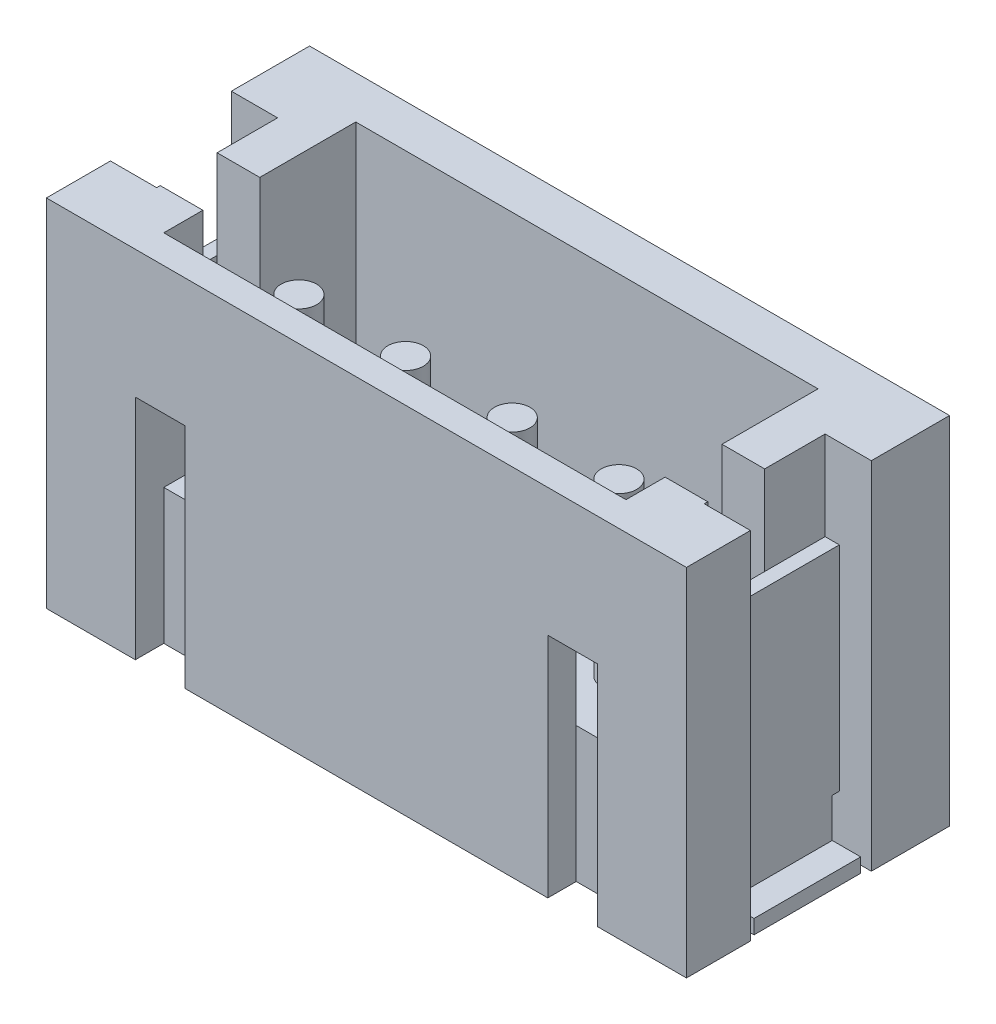
from build123d import *
from build123d.topology import SkipClean

# Parameters (mm, degrees)
BOSS_EXTRUDE1_START  = -2.55
BOSS_EXTRUDE1_DEPTH  = 5.1
SKETCH2_W            = 5.1
SKETCH2_H            = 1.9
BOSS_EXTRUDE2_DEPTH  = 1.75
SKETCH3_W            = 5.100000167
SKETCH3_H            = 0.4
BOSS_EXTRUDE3_DEPTH  = 3.1
SKETCH4_W            = 5.1
SKETCH4_H            = 1.6
BOSS_EXTRUDE4_DEPTH  = 1.05
BOSS_EXTRUDE5_DEPTH  = 0.700000167
SKETCH6_W            = 0.4
SKETCH6_H            = 1.8
BOSS_EXTRUDE6_DEPTH  = 0.7
SKETCH7_W            = 0.4
SKETCH7_H            = 1.8
BOSS_EXTRUDE7_DEPTH  = 0.7
BOSS_EXTRUDE8_DEPTH  = 0.7
SKETCH9_W            = 3.1
SKETCH9_H            = 5
BOSS_EXTRUDE9_DEPTH  = 1.25
SKETCH10_W           = 3.1
SKETCH10_H           = 5
BOSS_EXTRUDE10_DEPTH = 1.25
SKETCH11_W           = 9
SKETCH11_H           = 5
BOSS_EXTRUDE11_DEPTH = 0.6
CUT_EXTRUDE1_DEPTH   = 0.5
SKETCH13_W           = 0.45
SKETCH13_H           = 1.7
CUT_EXTRUDE2_DEPTH   = 8.677239185
CUT_EXTRUDE3_REACH   = 12.573
SKETCH14_W           = 0.8
SKETCH14_H           = 1.25
SKETCH15_W           = 0.85
SKETCH15_H           = 1.25
CUT_EXTRUDE4_DEPTH   = 0.2
SKETCH16_W           = 0.05
SKETCH16_H           = 1.25
CUT_EXTRUDE5_DEPTH   = 0.2
CUT_EXTRUDE6_REACH   = 8.647
SKETCH18_W           = 0.6
SKETCH18_H           = 0.8
SKETCH19_W           = 0.45
SKETCH19_H           = 1.7
CUT_EXTRUDE7_DEPTH   = 8.677239185
SKETCH20_W           = 0.8
SKETCH20_H           = 1.25
CUT_EXTRUDE8_DEPTH   = 11.573197246
SKETCH21_W           = 0.85
SKETCH21_H           = 1.25
CUT_EXTRUDE9_DEPTH   = 0.2
CUT_EXTRUDE10_REACH  = 12.412
SKETCH23_W           = 0.1
SKETCH23_H           = 0.75
SKETCH24_W           = 1.5
SKETCH24_H           = 0.2
BOSS_EXTRUDE12_DEPTH = 0.4
CUT_EXTRUDE11_REACH  = 12.412
SKETCH26_W           = 0.1
SKETCH26_H           = 0.75
CUT_EXTRUDE12_REACH  = 12.412
SKETCH28_W           = 0.75
SKETCH28_H           = 0.1
SKETCH29_W           = 1.5
SKETCH29_H           = 0.2
BOSS_EXTRUDE13_DEPTH = 0.4
CUT_EXTRUDE13_REACH  = 12.412
SKETCH31_W           = 0.75
SKETCH31_H           = 0.1
SKETCH32_W           = 0.05
SKETCH32_H           = 1.25
CUT_EXTRUDE14_DEPTH  = 0.2
CUT_EXTRUDE15_REACH  = 8.647
SKETCH34_W           = 0.6
SKETCH34_H           = 0.8
SKETCH35_W           = 0.25
SKETCH35_H           = 2.4
SKETCH36_W           = 0.25
SKETCH36_H           = 2.4
SKETCH37_W           = 0.25
SKETCH37_H           = 2.4
SKETCH38_W           = 0.25
SKETCH38_H           = 2.4
SKETCH39_W           = 0.25
SKETCH39_H           = 1.5
SKETCH40_W           = 0.25
SKETCH40_H           = 1.5
SKETCH41_W           = 0.25
SKETCH41_H           = 1.5
SKETCH42_W           = 0.25
SKETCH42_H           = 1.5


with BuildPart() as part:
    # Boss-Extrude1: read off the stored shape, not the designer's step
    # Boss-Extrude1 outline → Boss-Extrude1 (new body)
    with BuildSketch(Plane.YZ.offset(BOSS_EXTRUDE1_START)):
        Polygon((0, -2.05), (1.6, -2.05), (1.9, -1.75), (0, -1.75), align=None)
    extrude(amount=BOSS_EXTRUDE1_DEPTH)

    # Sketch2 → Boss-Extrude2 (add)
    with BuildSketch(Plane.XY.offset(-1.75)):
        with Locations((0, 0.95)):
            Rectangle(SKETCH2_W, SKETCH2_H)
    extrude(amount=BOSS_EXTRUDE2_DEPTH)

    # Sketch3 → Boss-Extrude3 (add)
    with BuildSketch(Plane(origin=(0, 1.9, 0), x_dir=(-1, 0, 0), z_dir=(0, 1, 0))):
        with Locations((-8.4e-08, -0.2)):
            Rectangle(SKETCH3_W, SKETCH3_H)
    extrude(amount=BOSS_EXTRUDE3_DEPTH)

    # Sketch4 → Boss-Extrude4 (add)
    with BuildSketch(Plane(origin=(0, 0, -2.05), x_dir=(-1, 0, 0), z_dir=(0, 0, -1))):
        with Locations((0, 0.8)):
            Rectangle(SKETCH4_W, SKETCH4_H)
    extrude(amount=BOSS_EXTRUDE4_DEPTH)

    # Sketch5 → Boss-Extrude5 (add)
    with BuildSketch(Plane(origin=(2.55, 0, 0), x_dir=(0, 0, -1), z_dir=(1, 0, 0))):
        Polygon((3.1, 0), (0.4, 0), (0.4, 1.9), (1.75, 1.9), (2.05, 1.6), (3.1, 1.6), align=None)
    extrude(amount=BOSS_EXTRUDE5_DEPTH)

    # Sketch6 → Boss-Extrude6 (add)
    with BuildSketch(Plane(origin=(2.55, 0, 0), x_dir=(0, 0, -1), z_dir=(1, 0, 0))):
        with Locations((0.2, 4.1)):
            Rectangle(SKETCH6_W, SKETCH6_H)
    extrude(amount=BOSS_EXTRUDE6_DEPTH)

    # Sketch7 → Boss-Extrude7 (add)
    with BuildSketch(Plane.ZY.offset(2.55)):
        with Locations((-0.2, 4.1)):
            Rectangle(SKETCH7_W, SKETCH7_H)
    extrude(amount=BOSS_EXTRUDE7_DEPTH)

    # Sketch8 → Boss-Extrude8 (add)
    with BuildSketch(Plane.ZY.offset(2.55)):
        Polygon((-0.4, 1.9), (-0.4, 0), (-3.1, 0), (-3.1, 1.6), (-2.05, 1.6), (-1.75, 1.9), align=None)
    extrude(amount=BOSS_EXTRUDE8_DEPTH)

    # Sketch9 → Boss-Extrude9 (add)
    with BuildSketch(Plane.ZY.offset(3.25)):
        with Locations((-1.55, 2.5)):
            Rectangle(SKETCH9_W, SKETCH9_H)
    extrude(amount=BOSS_EXTRUDE9_DEPTH)

    # Sketch10 → Boss-Extrude10 (add)
    with BuildSketch(Plane(origin=(3.250000167, 0, 0), x_dir=(0, 0, -1), z_dir=(1, 0, 0))):
        with Locations((1.55, 2.5)):
            Rectangle(SKETCH10_W, SKETCH10_H)
    extrude(amount=BOSS_EXTRUDE10_DEPTH)

    # Sketch11 → Boss-Extrude11 (add)
    with SkipClean():  # the faces are left unmerged after this step: merging them gives an invalid solid
        with BuildSketch(Plane(origin=(0, 0, -3.1), x_dir=(-1, 0, 0), z_dir=(0, 0, -1))):
            with Locations((0, 2.5)):
                Rectangle(SKETCH11_W, SKETCH11_H)
        extrude(amount=BOSS_EXTRUDE11_DEPTH)

    # Sketch12 → Cut-Extrude1 (cut)
    with SkipClean():  # the faces are left unmerged after this step: merging them gives an invalid solid
        with BuildSketch(Plane.ZY.offset(-3.250000167)):
            Polygon((-3.1, 1.6), (-2.05, 1.6), (-1.75, 1.9), (-3.1, 1.9), align=None)
        extrude(amount=-CUT_EXTRUDE1_DEPTH, mode=Mode.SUBTRACT)

    # Sketch13 → Cut-Extrude2 (cut, through all)
    with SkipClean():  # the faces are left unmerged after this step: merging them gives an invalid solid
        with BuildSketch(Plane.XZ):
            with Locations((-4.275, -1.75)):
                Rectangle(SKETCH13_W, SKETCH13_H)
        extrude(amount=-CUT_EXTRUDE2_DEPTH, mode=Mode.SUBTRACT)

    # Sketch14 → Cut-Extrude3 (cut, up to next)
    with BuildSketch(Plane.ZY.offset(4.05), mode=Mode.PRIVATE) as cut_extrude3_sk1:
        with Locations((-1.35, 4.375)):
            Rectangle(SKETCH14_W, SKETCH14_H)
    cut_extrude3_tool1 = extrude(cut_extrude3_sk1.sketch, amount=-CUT_EXTRUDE3_REACH, mode=Mode.PRIVATE) & part.part
    add(cut_extrude3_tool1.solids().sort_by_distance((-4.05, 4.375, -1.35))[0], mode=Mode.SUBTRACT)

    # Sketch15 → Cut-Extrude4 (cut)
    with SkipClean():  # the faces are left unmerged after this step: merging them gives an invalid solid
        with BuildSketch(Plane.ZY.offset(4.05)):
            with Locations((-2.175, 4.375)):
                Rectangle(SKETCH15_W, SKETCH15_H)
        extrude(amount=-CUT_EXTRUDE4_DEPTH, mode=Mode.SUBTRACT)

    # Sketch16 → Cut-Extrude5 (cut)
    with SkipClean():  # the faces are left unmerged after this step: merging them gives an invalid solid
        with BuildSketch(Plane.ZY.offset(4.05)):
            with Locations((-0.925, 4.375)):
                Rectangle(SKETCH16_W, SKETCH16_H)
        extrude(amount=-CUT_EXTRUDE5_DEPTH, mode=Mode.SUBTRACT)

    # Sketch18 → Cut-Extrude6 (cut, up to next)
    with BuildSketch(Plane.XZ.offset(-3.2), mode=Mode.PRIVATE) as cut_extrude6_sk1:
        with Locations((-3.55, -1.35)):
            Rectangle(SKETCH18_W, SKETCH18_H)
    cut_extrude6_tool1 = extrude(cut_extrude6_sk1.sketch, amount=-CUT_EXTRUDE6_REACH, mode=Mode.PRIVATE) & part.part
    add(cut_extrude6_tool1.solids().sort_by_distance((-3.55, 3.2, -1.35))[0], mode=Mode.SUBTRACT)

    # Sketch19 → Cut-Extrude7 (cut, through all)
    with SkipClean():  # the faces are left unmerged after this step: merging them gives an invalid solid
        with BuildSketch(Plane.XZ):
            with Locations((4.275, -1.75)):
                Rectangle(SKETCH19_W, SKETCH19_H)
        extrude(amount=-CUT_EXTRUDE7_DEPTH, mode=Mode.SUBTRACT)

    # Sketch20 → Cut-Extrude8 (cut, through all)
    with SkipClean():  # the faces are left unmerged after this step: merging them gives an invalid solid
        with BuildSketch(Plane(origin=(4.05, 0, 0), x_dir=(0, 0, -1), z_dir=(1, 0, 0))):
            with Locations((1.35, 4.375)):
                Rectangle(SKETCH20_W, SKETCH20_H)
        extrude(amount=-CUT_EXTRUDE8_DEPTH, mode=Mode.SUBTRACT)

    # Sketch21 → Cut-Extrude9 (cut)
    with SkipClean():  # the faces are left unmerged after this step: merging them gives an invalid solid
        with BuildSketch(Plane(origin=(4.05, 0, 0), x_dir=(0, 0, -1), z_dir=(1, 0, 0))):
            with Locations((2.175, 4.375)):
                Rectangle(SKETCH21_W, SKETCH21_H)
        extrude(amount=-CUT_EXTRUDE9_DEPTH, mode=Mode.SUBTRACT)

    # Sketch23 → Cut-Extrude10 (cut, up to next)
    with BuildSketch(Plane(origin=(-3.85, 0, 0), x_dir=(0, 0, -1), z_dir=(1, 0, 0)), mode=Mode.PRIVATE) as cut_extrude10_sk1:
        with Locations((0.95, 0.375)):
            Rectangle(SKETCH23_W, SKETCH23_H)
    cut_extrude10_tool1 = extrude(cut_extrude10_sk1.sketch, amount=-CUT_EXTRUDE10_REACH, mode=Mode.PRIVATE) & part.part
    add(cut_extrude10_tool1.solids().sort_by_distance((-3.85, 0.375, -0.95))[0], mode=Mode.SUBTRACT)

    # Sketch24 → Boss-Extrude12 (add)
    with SkipClean():  # the faces are left unmerged after this step: merging them gives an invalid solid
        with BuildSketch(Plane.ZY.offset(4.05)):
            with Locations((-1.75, 0.1)):
                Rectangle(SKETCH24_W, SKETCH24_H)
        extrude(amount=BOSS_EXTRUDE12_DEPTH)

    # Sketch26 → Cut-Extrude11 (cut, up to next)
    with BuildSketch(Plane(origin=(-3.85, 0, 0), x_dir=(0, 0, -1), z_dir=(1, 0, 0)), mode=Mode.PRIVATE) as cut_extrude11_sk1:
        with Locations((2.55, 0.375)):
            Rectangle(SKETCH26_W, SKETCH26_H)
    cut_extrude11_tool1 = extrude(cut_extrude11_sk1.sketch, amount=-CUT_EXTRUDE11_REACH, mode=Mode.PRIVATE) & part.part
    add(cut_extrude11_tool1.solids().sort_by_distance((-3.85, 0.375, -2.55))[0], mode=Mode.SUBTRACT)

    # Sketch28 → Cut-Extrude12 (cut, up to next)
    with BuildSketch(Plane(origin=(3.85, 0, 0), x_dir=(0, -1, 0), z_dir=(-1, 0, 0)), mode=Mode.PRIVATE) as cut_extrude12_sk1:
        with Locations((-0.375, -2.55)):
            Rectangle(SKETCH28_W, SKETCH28_H)
    cut_extrude12_tool1 = extrude(cut_extrude12_sk1.sketch, amount=-CUT_EXTRUDE12_REACH, mode=Mode.PRIVATE) & part.part
    add(cut_extrude12_tool1.solids().sort_by_distance((3.85, 0.375, -2.55))[0], mode=Mode.SUBTRACT)

    # Sketch29 → Boss-Extrude13 (add)
    with SkipClean():  # the faces are left unmerged after this step: merging them gives an invalid solid
        with BuildSketch(Plane(origin=(4.05, 0, 0), x_dir=(0, 0, -1), z_dir=(1, 0, 0))):
            with Locations((1.75, 0.1)):
                Rectangle(SKETCH29_W, SKETCH29_H)
        extrude(amount=BOSS_EXTRUDE13_DEPTH)

    # Sketch31 → Cut-Extrude13 (cut, up to next)
    with BuildSketch(Plane(origin=(3.85, 0, 0), x_dir=(0, -1, 0), z_dir=(-1, 0, 0)), mode=Mode.PRIVATE) as cut_extrude13_sk1:
        with Locations((-0.375, -0.95)):
            Rectangle(SKETCH31_W, SKETCH31_H)
    cut_extrude13_tool1 = extrude(cut_extrude13_sk1.sketch, amount=-CUT_EXTRUDE13_REACH, mode=Mode.PRIVATE) & part.part
    add(cut_extrude13_tool1.solids().sort_by_distance((3.85, 0.375, -0.95))[0], mode=Mode.SUBTRACT)

    # Sketch32 → Cut-Extrude14 (cut)
    with SkipClean():  # the faces are left unmerged after this step: merging them gives an invalid solid
        with BuildSketch(Plane(origin=(4.05, 0, 0), x_dir=(0, 0, -1), z_dir=(1, 0, 0))):
            with Locations((0.925, 4.375)):
                Rectangle(SKETCH32_W, SKETCH32_H)
        extrude(amount=-CUT_EXTRUDE14_DEPTH, mode=Mode.SUBTRACT)

    # Sketch34 → Cut-Extrude15 (cut, up to next)
    with BuildSketch(Plane.XZ.offset(-3.2), mode=Mode.PRIVATE) as cut_extrude15_sk1:
        with Locations((3.55, -1.35)):
            Rectangle(SKETCH34_W, SKETCH34_H)
    cut_extrude15_tool1 = extrude(cut_extrude15_sk1.sketch, amount=-CUT_EXTRUDE15_REACH, mode=Mode.PRIVATE) & part.part
    add(cut_extrude15_tool1.solids().sort_by_distance((3.55, 3.2, -1.35))[0], mode=Mode.SUBTRACT)

    # Sketch35 → Revolve1 (revolve)
    with SkipClean():  # the faces are left unmerged after this step: merging them gives an invalid solid
        with BuildSketch(Plane(origin=(0, 0, -1.3), x_dir=(-1, 0, 0), z_dir=(0, 0, -1)), mode=Mode.PRIVATE) as revolve1_sk:
            with Locations((-2.375, 3.1)):
                Rectangle(SKETCH35_W, SKETCH35_H)
        revolve(revolve1_sk.sketch.rotate(Axis((2.25, 1.9, -1.3), (0, 1, 0)), 270), axis=Axis((2.25, 1.9, -1.3), (0, 1, 0)))

    # Sketch36 → Revolve2 (revolve)
    with SkipClean():  # the faces are left unmerged after this step: merging them gives an invalid solid
        with BuildSketch(Plane(origin=(0, 0, -1.3), x_dir=(-1, 0, 0), z_dir=(0, 0, -1)), mode=Mode.PRIVATE) as revolve2_sk:
            with Locations((-0.875, 3.1)):
                Rectangle(SKETCH36_W, SKETCH36_H)
        revolve(revolve2_sk.sketch.rotate(Axis((0.75, 1.9, -1.3), (0, 1, 0)), 180), axis=Axis((0.75, 1.9, -1.3), (0, 1, 0)))

    # Sketch37 → Revolve3 (revolve)
    with SkipClean():  # the faces are left unmerged after this step: merging them gives an invalid solid
        with BuildSketch(Plane(origin=(0, 0, -1.3), x_dir=(-1, 0, 0), z_dir=(0, 0, -1)), mode=Mode.PRIVATE) as revolve3_sk:
            with Locations((0.625, 3.1)):
                Rectangle(SKETCH37_W, SKETCH37_H)
        revolve(revolve3_sk.sketch.rotate(Axis((-0.75, 1.9, -1.3), (0, 1, 0)), 270), axis=Axis((-0.75, 1.9, -1.3), (0, 1, 0)))

    # Sketch38 → Revolve4 (revolve)
    with SkipClean():  # the faces are left unmerged after this step: merging them gives an invalid solid
        with BuildSketch(Plane(origin=(0, 0, -1.3), x_dir=(-1, 0, 0), z_dir=(0, 0, -1)), mode=Mode.PRIVATE) as revolve4_sk:
            with Locations((2.125, 3.1)):
                Rectangle(SKETCH38_W, SKETCH38_H)
        revolve(revolve4_sk.sketch.rotate(Axis((-2.25, 1.9, -1.3), (0, 1, 0)), 270), axis=Axis((-2.25, 1.9, -1.3), (0, 1, 0)))

    # Sketch39 → Revolve5 (revolve)
    with SkipClean():  # the faces are left unmerged after this step: merging them gives an invalid solid
        with BuildSketch(Plane.XZ.offset(-0.25), mode=Mode.PRIVATE) as revolve5_sk:
            with Locations((2.375, -4.45)):
                Rectangle(SKETCH39_W, SKETCH39_H)
        revolve(revolve5_sk.sketch.rotate(Axis((2.25, 0.25, -3.7), (0, 0, -1)), 180), axis=Axis((2.25, 0.25, -3.7), (0, 0, -1)))

    # Sketch40 → Revolve6 (revolve)
    with SkipClean():  # the faces are left unmerged after this step: merging them gives an invalid solid
        with BuildSketch(Plane.XZ.offset(-0.25), mode=Mode.PRIVATE) as revolve6_sk:
            with Locations((0.875, -4.45)):
                Rectangle(SKETCH40_W, SKETCH40_H)
        revolve(revolve6_sk.sketch.rotate(Axis((0.75, 0.25, -3.7), (0, 0, -1)), 180), axis=Axis((0.75, 0.25, -3.7), (0, 0, -1)))

    # Sketch41 → Revolve7 (revolve)
    with SkipClean():  # the faces are left unmerged after this step: merging them gives an invalid solid
        with BuildSketch(Plane.XZ.offset(-0.25), mode=Mode.PRIVATE) as revolve7_sk:
            with Locations((-0.625, -4.45)):
                Rectangle(SKETCH41_W, SKETCH41_H)
        revolve(revolve7_sk.sketch.rotate(Axis((-0.75, 0.25, -3.7), (0, 0, -1)), 180), axis=Axis((-0.75, 0.25, -3.7), (0, 0, -1)))

    # Sketch42 → Revolve8 (revolve)
    with SkipClean():  # the faces are left unmerged after this step: merging them gives an invalid solid
        with BuildSketch(Plane.XZ.offset(-0.25), mode=Mode.PRIVATE) as revolve8_sk:
            with Locations((-2.125, -4.45)):
                Rectangle(SKETCH42_W, SKETCH42_H)
        revolve(revolve8_sk.sketch.rotate(Axis((-2.25, 0.25, -3.7), (0, 0, -1)), 180), axis=Axis((-2.25, 0.25, -3.7), (0, 0, -1)))


solid = part.part
